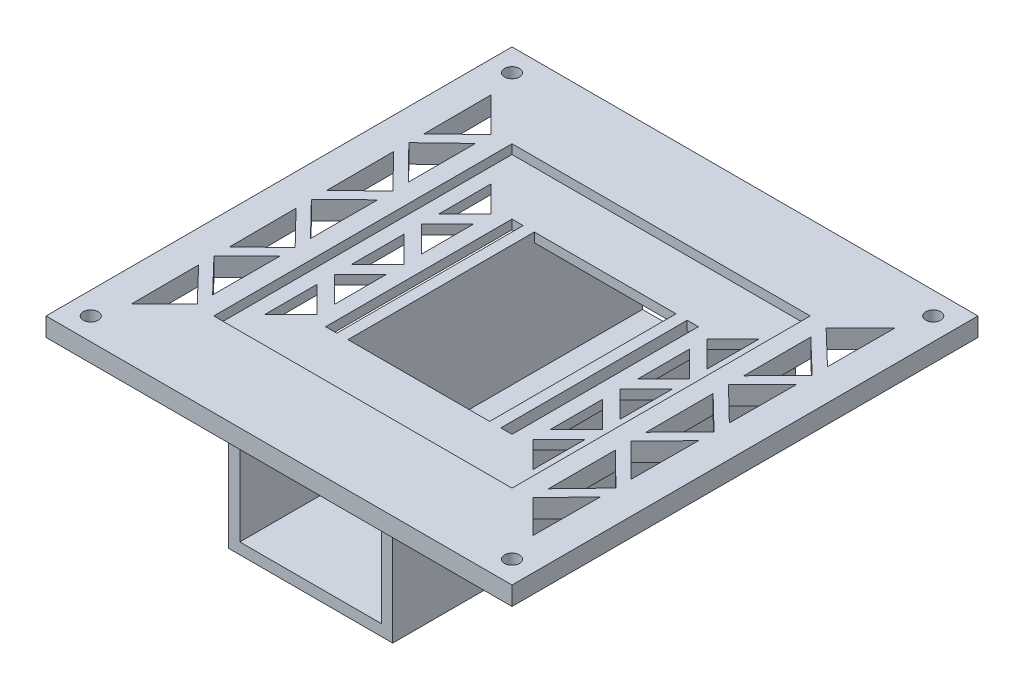
from build123d import *

# Parameters (mm, degrees)
SKETCH_2_W               = 125
SKETCH_2_H               = 125
SKETCH_2_R               = 2
SKETCH_2_W_2             = 50
SKETCH_2_H_2             = 50
EXTRUDE_1_DEPTH          = 2.5
EXTRUDE_4_DEPTH          = 54
SKETCH_7_W               = 80
SKETCH_7_H               = 80
CUT_EXTRUDE_1_DEPTH      = 10
CUT_EXTRUDE_2_DEPTH      = 97.210706265
CUT_EXTRUDE_2_DEPTH_BACK = 5


with BuildPart() as part:
    # 스케치2 → 보스-돌출1 (new, symmetric)
    with BuildSketch(Plane(origin=(0, 0, 0), x_dir=(1, 0, 0), z_dir=(0, 1, 0))):
        Rectangle(SKETCH_2_W, SKETCH_2_H)
        with Locations((-56.5, 56.5)):
            Circle(SKETCH_2_R, mode=Mode.SUBTRACT)
        with Locations((56.5, 56.5)):
            Circle(SKETCH_2_R, mode=Mode.SUBTRACT)
        with Locations((-56.5, -56.5)):
            Circle(SKETCH_2_R, mode=Mode.SUBTRACT)
        with Locations((56.5, -56.5)):
            Circle(SKETCH_2_R, mode=Mode.SUBTRACT)
        Rectangle(SKETCH_2_W_2, SKETCH_2_H_2, mode=Mode.SUBTRACT)
    extrude(amount=EXTRUDE_1_DEPTH, both=True)

    # 스케치6 → 보스-돌출4 (add, symmetric)
    with BuildSketch(Plane.XY):
        Polygon((-22, 0), (-22, -35.5), (22, -35.5), (22, 0), (19, 0), (19, -32.5), (-19, -32.5), (-19, 0), align=None)
    extrude(amount=EXTRUDE_4_DEPTH, both=True)

    # 스케치7 → 컷-돌출1 (cut)
    with BuildSketch(Plane(origin=(0, 0, 0), x_dir=(1, 0, 0), z_dir=(0, 1, 0))):
        Rectangle(SKETCH_7_W, SKETCH_7_H)
    extrude(amount=CUT_EXTRUDE_1_DEPTH, mode=Mode.SUBTRACT)

    # 스케치8 → 컷-돌출2 (cut, two sides: drawn at the far end of the back side and taken through both)
    with BuildSketch(Plane(origin=(0, 2.5, 0), x_dir=(1, 0, 0), z_dir=(0, 1, 0)).offset(-CUT_EXTRUDE_2_DEPTH_BACK)):
        Polygon((54.07931581, 22.285580831), (54.015526938, 4.28569386), (44.986382589, 13.073341514), align=None)
        Polygon((36, -30.343145751), (36, -16.343145751), (29, -23.343145751), align=None)
        Polygon((29, 18.671572875), (29, 4.671572875), (36, 11.671572875), align=None)
        Polygon((36, 30.343145751), (29, 23.343145751), (36, 16.343145751), align=None)
        Polygon((53.829622097, -48.172767848), (45.041121619, -39.384267369), (53.893419828, -30.170381277), align=None)
        Polygon((45.036831341, -35.272800588), (45.018048518, -17.272810388), (53.90806007, -26.039210725), align=None)
        Polygon((44.95901306, 39.30215881), (54.172270373, 48.515416123), (54.1084815, 30.515529152), align=None)
        Polygon((53.922585518, -21.940432956), (45.013752114, -13.155472476), (53.986361248, -3.944254461), align=None)
        Polygon((45.009460593, -9.042814869), (54.001004771, 0.18784173), (44.99067777, 8.957175331), align=None)
        Polygon((44.982089846, 17.187170851), (54.093962598, 26.418598199), (44.963307022, 35.187161051), align=None)
        Polygon((29, 0), (36, 7), (36, -7), align=None)
        Polygon((36, -11.671572875), (29, -4.671572875), (29, -18.671572875), align=None)
        Polygon((-36, -7), (-36, 7), (-29, 0), align=None)
        Polygon((-29, -4.671572875), (-29, -18.671572875), (-36, -11.671572875), align=None)
        Polygon((-36, 16.343145751), (-36, 30.343145751), (-29, 23.343145751), align=None)
        Polygon((-36, -16.343145751), (-29, -23.343145751), (-36, -30.343145751), align=None)
        Polygon((-36, 11.671572875), (-29, 4.671572875), (-29, 18.671572875), align=None)
        Polygon((-53.893419828, -30.170381277), (-53.829622097, -48.172767848), (-45.041121619, -39.384267369), align=None)
        Polygon((-45.009460593, -9.042814869), (-44.99067777, 8.957175331), (-54.001004771, 0.18784173), align=None)
        Polygon((-53.986361248, -3.944254461), (-53.922585518, -21.940432956), (-45.013752114, -13.155472476), align=None)
        Polygon((-44.982089846, 17.187170851), (-44.963307022, 35.187161051), (-54.093962598, 26.418598199), align=None)
        Polygon((-54.1084815, 30.515529152), (-44.95901306, 39.30215881), (-54.172270373, 48.515416123), align=None)
        Polygon((-44.986382589, 13.073341514), (-54.07931581, 22.285580831), (-54.015526938, 4.28569386), align=None)
        Polygon((-53.90806007, -26.039210725), (-45.018048518, -17.272810388), (-45.036831341, -35.272800588), align=None)
    extrude(amount=CUT_EXTRUDE_2_DEPTH + CUT_EXTRUDE_2_DEPTH_BACK, mode=Mode.SUBTRACT)


solid = part.part
